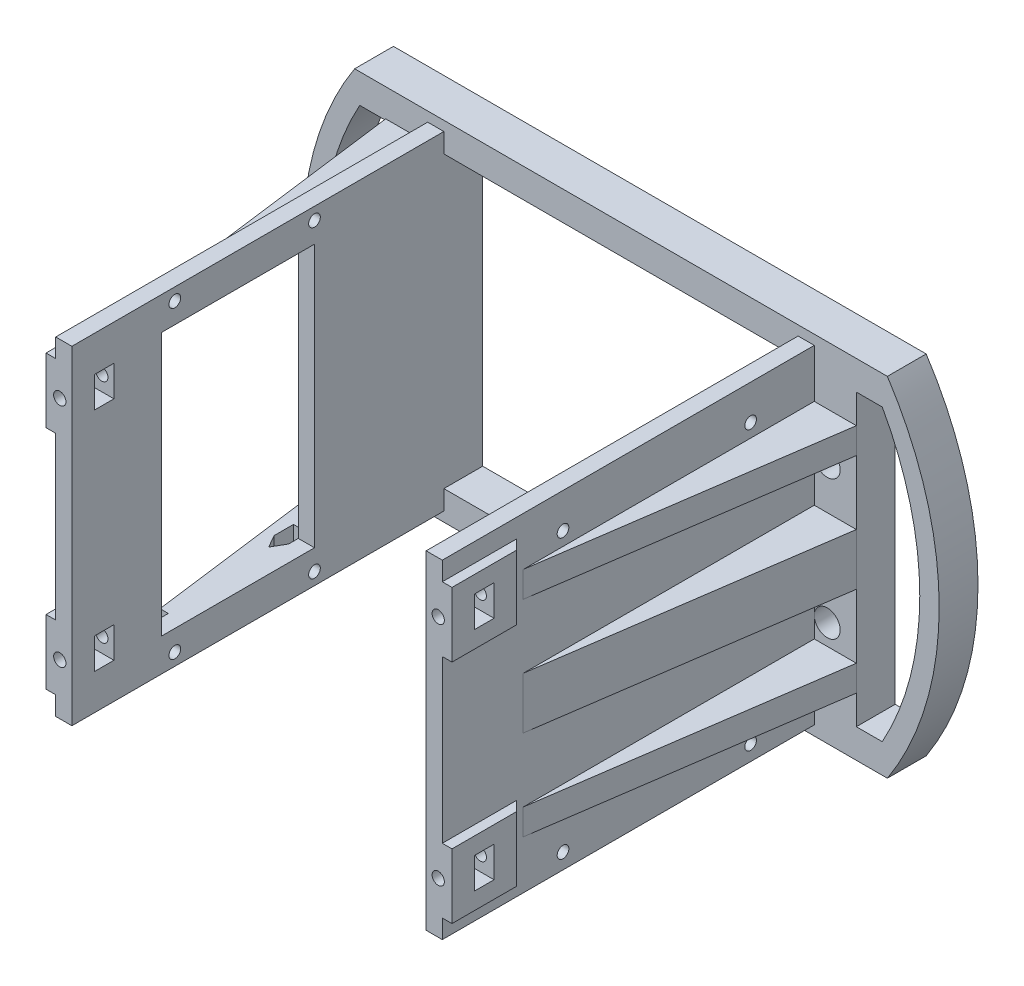
from build123d import *

# Parameters (mm, degrees)
SKETCH1_W                 = 152.4
SKETCH1_H                 = 101.6
BOSS_EXTRUDE1_DEPTH       = 12
F_6_CLEARANCE_HOLE1_D     = 3.7973
BOSS_EXTRUDE2_DEPTH       = 12
SKETCH6_R                 = 4
CUT_EXTRUDE2_DEPTH        = 9.525
SKETCH5_W                 = 109.508
SKETCH5_H                 = 89.6
CUT_EXTRUDE1_DEPTH        = 112.353602017
SKETCH7_W                 = 5
SKETCH7_H                 = 101.6
BOSS_EXTRUDE3_DEPTH       = 100
M3_CLEARANCE_HOLE1_D      = 3.6
SKETCH9_W                 = 47.3
SKETCH9_H                 = 81.28
CUT_EXTRUDE3_DEPTH        = 197.389908957
BOSS_EXTRUDE4_START       = -45.19
BOSS_EXTRUDE4_DEPTH       = 4.55
BOSS_EXTRUDE4_START_2     = 40.64
BOSS_EXTRUDE4_2_DEPTH     = 4.55
CUT_EXTRUDE7_DEPTH        = 178.293724599
CUT_EXTRUDE7_DEPTH_BACK   = 178.293724599
SKETCH12_W                = 5
SKETCH12_H                = 101.6
BOSS_EXTRUDE5_DEPTH       = 90
M3_CLEARANCE_HOLE2_D      = 3.6
M3_CLEARANCE_HOLE2_DEPTH  = 43.6075
BOSS_EXTRUDE6_REACH       = 207.494
SKETCH14_W                = 90.93404203
SKETCH14_H                = 16
SKETCH14_H_2              = 8
BOSS_EXTRUDE7_DEPTH       = 25
BOSS_EXTRUDE8_REACH       = 170.477
SKETCH16_W                = 5
SKETCH16_H                = 101.6
SKETCH27_W                = 25
SKETCH27_H                = 20
BOSS_EXTRUDE10_DEPTH      = 3
CHAMFER1_SIZE             = 5
CHAMFER1_OF_MIRROR1_SIZE  = 5
CUT_EXTRUDE6_DEPTH        = 210.069728417
CUT_EXTRUDE6_DEPTH_BACK   = 210.069728417
SKETCH19_W                = 6
SKETCH19_H                = 9.525
BOSS_EXTRUDE9_START       = -12
BOSS_EXTRUDE9_DEPTH       = 12
F_6_CLEARANCE_HOLE2_D     = 3.7973
F_6_CLEARANCE_HOLE2_DEPTH = 18.859175986
F_6_CLEARANCE_HOLE2_TIP   = 1.140824014


# Read off the part's stored shape, not the designer's step: Boss-Extrude4
with BuildPart() as part:
    # Sketch1 → Boss-Extrude1 (new body)
    with BuildSketch(Plane.XY):
        Rectangle(SKETCH1_W, SKETCH1_H)
    extrude(amount=BOSS_EXTRUDE1_DEPTH)

    # #6 Clearance Hole1 (through all)
    with Locations(Plane(origin=(-63.754, 21.46427, 12), x_dir=(1, 0, 0), z_dir=(0, 0, 1))):
        with Locations((0, 0), (127.508, 0), (127.508, -43.18), (0, -43.18), (63.754, 0), (63.754, -43.18)):
            Hole(F_6_CLEARANCE_HOLE1_D / 2)

    # Sketch4 → Boss-Extrude2 (add)
    with BuildSketch(Plane.XY.offset(12)):
        with BuildLine():
            Line((-76.2, 50.8), (-84.22793291, 50.8))
            ThreePointArc((-84.22793291, 50.8), (-98.3615, 0), (-84.22793291, -50.8))
            Line((-84.22793291, -50.8), (-76.2, -50.8))
            Line((-76.2, -50.8), (-76.2, 50.8))
        make_face()
        with BuildLine():
            Line((76.2, -50.8), (84.22793291, -50.8))
            ThreePointArc((84.22793291, -50.8), (98.3615, 0), (84.22793291, 50.8))
            Line((84.22793291, 50.8), (76.2, 50.8))
            Line((76.2, 50.8), (76.2, -50.8))
        make_face()
    extrude(amount=-BOSS_EXTRUDE2_DEPTH)

    # Sketch6 → Cut-Extrude2 (cut)
    with BuildSketch(Plane.XY.offset(12)):
        with Locations((-63.754, 21.46427)):
            Circle(SKETCH6_R)
        with Locations((63.754, 21.46427)):
            Circle(SKETCH6_R)
        with Locations((63.754, -21.46427)):
            Circle(SKETCH6_R)
        with Locations((-63.754, -21.46427)):
            Circle(SKETCH6_R)
    extrude(amount=-CUT_EXTRUDE2_DEPTH, mode=Mode.SUBTRACT)

    # Sketch5 → Cut-Extrude1 (cut, through all)
    with BuildSketch(Plane.XY.offset(12)):
        with BuildLine():
            Line((-72.754, 44.8), (-72.754, -44.8))
            Line((-72.754, -44.8), (-80.768847226, -44.8))
            ThreePointArc((-80.768847226, -44.8), (-92.3615, 0), (-80.768847226, 44.8))
            Line((-80.768847226, 44.8), (-72.754, 44.8))
        make_face()
        with BuildLine():
            Line((72.754, 44.8), (72.754, -44.8))
            Line((72.754, -44.8), (80.768847226, -44.8))
            ThreePointArc((80.768847226, -44.8), (92.3615, 0), (80.768847226, 44.8))
            Line((80.768847226, 44.8), (72.754, 44.8))
        make_face()
        Rectangle(SKETCH5_W, SKETCH5_H)
    extrude(amount=-CUT_EXTRUDE1_DEPTH, mode=Mode.SUBTRACT)

    # Sketch7 → Boss-Extrude3 (add)
    with BuildSketch(Plane.XY.offset(12)):
        with Locations((-57.254, 0)):
            Rectangle(SKETCH7_W, SKETCH7_H)
    extrude(amount=BOSS_EXTRUDE3_DEPTH)

    # M3 Clearance Hole1 (through all)
    with Locations(Plane(origin=(-54.754, 46.99, 95.18), x_dir=(0, 1, 0), z_dir=(1, 0, 0))):
        with Locations((0, 0), (0, -43.18), (-93.98, -43.18), (-93.98, 0)):
            Hole(M3_CLEARANCE_HOLE1_D / 2)

    # Sketch9 → Cut-Extrude3 (cut, through all)
    with BuildSketch(Plane(origin=(-54.754, 0, 0), x_dir=(0, 0, -1), z_dir=(1, 0, 0))):
        with Locations((-75.65, 0)):
            Rectangle(SKETCH9_W, SKETCH9_H)
    extrude(amount=-CUT_EXTRUDE3_DEPTH, mode=Mode.SUBTRACT)

    # Boss-Extrude4 outline → Boss-Extrude4 (add)
    with BuildSketch(Plane(origin=(0, 0, 0), x_dir=(1, 0, 0), z_dir=(0, 1, 0)).offset(BOSS_EXTRUDE4_START)):
        Polygon((-59.754, -12), (-72.754, -12), (-59.754, -112), align=None)
    extrude(amount=BOSS_EXTRUDE4_DEPTH)

    # Boss-Extrude4 2 outline → Boss-Extrude4 2 (add)
    with BuildSketch(Plane(origin=(0, 0, 0), x_dir=(1, 0, 0), z_dir=(0, 1, 0)).offset(BOSS_EXTRUDE4_START_2)):
        Polygon((-59.754, -12), (-72.754, -12), (-59.754, -112), align=None)
    extrude(amount=BOSS_EXTRUDE4_2_DEPTH)

    # Sketch25 → Cut-Extrude7 (cut, two sides: drawn at the far end of the back side and taken through both)
    with BuildSketch(Plane.XZ.offset(45.19).offset(-CUT_EXTRUDE7_DEPTH_BACK)):
        Polygon((-59.754, 112), (-62.3306, 92.18), (-59.754, 92.18), align=None)
        Polygon((-59.754, 49), (-59.754, 55), (-62.004, 58.897114317), (-64.254, 55), (-64.254, 49), align=None)
    extrude(amount=CUT_EXTRUDE7_DEPTH + CUT_EXTRUDE7_DEPTH_BACK, mode=Mode.SUBTRACT)

    # Sketch12 → Boss-Extrude5 (add)
    with BuildSketch(Plane.XY.offset(12)):
        with Locations((57.254, 0)):
            Rectangle(SKETCH12_W, SKETCH12_H)
    extrude(amount=BOSS_EXTRUDE5_DEPTH)

    # M3 Clearance Hole2
    with Locations(Plane(origin=(54.754, -46, 89.68), x_dir=(0, 0, -1), z_dir=(-1, 0, 0))):
        with Locations((0, 0), (58, 0), (58, -86), (0, -86)):
            Hole(M3_CLEARANCE_HOLE2_D / 2, depth=M3_CLEARANCE_HOLE2_DEPTH)

    # Boss-Extrude6: up to this face of the body (flat: up to its plane)
    boss_extrude6_end = Plane(part.part.faces().sort_by_distance((59.754, 0.013417697, 56.983540958))[0])
    # Sketch14 → Boss-Extrude6 (add, up to the picked face)
    with BuildSketch(Plane(origin=(72.964977627, 0, 10.539385657), x_dir=(-0.14296076265523758, 0, 0.9897283568439539), z_dir=(-0.9897283568439539, 0, -0.14296076265523758)), mode=Mode.PRIVATE) as boss_extrude6_sk1:
        with Locations((46.942793971, 0)):
            Rectangle(SKETCH14_W, SKETCH14_H)
    boss_extrude6_tool1 = split(extrude(boss_extrude6_sk1.sketch, amount=BOSS_EXTRUDE6_REACH, mode=Mode.PRIVATE), bisect_by=boss_extrude6_end, keep=Keep.BOTH, mode=Mode.PRIVATE)
    # Sketch14 → Boss-Extrude6 (add, up to the picked face)
    with BuildSketch(Plane(origin=(72.964977627, 0, 10.539385657), x_dir=(-0.14296076265523758, 0, 0.9897283568439539), z_dir=(-0.9897283568439539, 0, -0.14296076265523758)), mode=Mode.PRIVATE) as boss_extrude6_sk2:
        with Locations((46.942793971, -31.8)):
            Rectangle(SKETCH14_W, SKETCH14_H_2)
    boss_extrude6_tool2 = split(extrude(boss_extrude6_sk2.sketch, amount=BOSS_EXTRUDE6_REACH, mode=Mode.PRIVATE), bisect_by=boss_extrude6_end, keep=Keep.BOTH, mode=Mode.PRIVATE)
    # Sketch14 → Boss-Extrude6 (add, up to the picked face)
    with BuildSketch(Plane(origin=(72.964977627, 0, 10.539385657), x_dir=(-0.14296076265523758, 0, 0.9897283568439539), z_dir=(-0.9897283568439539, 0, -0.14296076265523758)), mode=Mode.PRIVATE) as boss_extrude6_sk3:
        with Locations((46.942793971, 31.8)):
            Rectangle(SKETCH14_W, SKETCH14_H_2)
    boss_extrude6_tool3 = split(extrude(boss_extrude6_sk3.sketch, amount=BOSS_EXTRUDE6_REACH, mode=Mode.PRIVATE), bisect_by=boss_extrude6_end, keep=Keep.BOTH, mode=Mode.PRIVATE)
    add(boss_extrude6_tool1.solids().sort_by(Axis((66.254, 0, 57), (-0.9897283568439539, 0, -0.14296076265523758)))[0])
    add(boss_extrude6_tool2.solids().sort_by(Axis((66.254, -31.8, 57), (-0.9897283568439539, 0, -0.14296076265523758)))[0])
    add(boss_extrude6_tool3.solids().sort_by(Axis((66.254, 31.8, 57), (-0.9897283568439539, 0, -0.14296076265523758)))[0])

    # Sketch15 → Boss-Extrude7 (add)
    with BuildSketch(Plane.XY.offset(102)):
        Polygon((59.754, -8), (59.754, 8), (59.754, 27.8), (59.754, 35.8), (59.754, 50.8), (54.754, 50.8), (54.754, -50.8), (59.754, -50.8), (59.754, -35.8), (59.754, -27.8), align=None)
    extrude(amount=BOSS_EXTRUDE7_DEPTH)

    # Sketch16 → Boss-Extrude8 (add, up to next)
    with BuildSketch(Plane.XY.offset(127), mode=Mode.PRIVATE) as boss_extrude8_sk1:
        with Locations((-57.254, 0)):
            Rectangle(SKETCH16_W, SKETCH16_H)
    boss_extrude8_tool1 = extrude(boss_extrude8_sk1.sketch, amount=-BOSS_EXTRUDE8_REACH, mode=Mode.PRIVATE) - part.part
    add(boss_extrude8_tool1.solids().sort_by_distance((-57.254, 0, 127))[0])

    # Sketch27 → Boss-Extrude10 (add)
    with BuildSketch(Plane.ZY.offset(59.754)):
        with Locations((114.5, 35)):
            Rectangle(SKETCH27_W, SKETCH27_H)
        with Locations((114.5, -35)):
            Rectangle(SKETCH27_W, SKETCH27_H)
    boss_extrude10 = extrude(amount=BOSS_EXTRUDE10_DEPTH)

    # Chamfer1
    # the kernel refuses this chamfer: 5 mm, written as the material it takes off along each edge
    with BuildSketch(Plane(origin=(-62.754, -57.85841494, 102), x_dir=(0.9996219169112968, 0, -0.0274958766105877), z_dir=(0, 1, 0))) as chamfer1_piece_1_section:
        Polygon((CHAMFER1_SIZE * 0.999621916911, -CHAMFER1_SIZE * 0.0274958766106), (-CHAMFER1_SIZE * 0.0274958766106, -CHAMFER1_SIZE * 0.999621916911), (0, 0), align=None)
    chamfer1_piece_1 = extrude(amount=45.71682988, mode=Mode.PRIVATE)
    chamfer1_piece_1 = split(chamfer1_piece_1, bisect_by=Plane(origin=(-59.754, -35, 103.875047298), z_dir=(-1, 0, 0)), keep=Keep.TOP, mode=Mode.PRIVATE)
    add(chamfer1_piece_1, mode=Mode.SUBTRACT)
    with BuildSketch(Plane(origin=(-62.754, 12.14158506, 102), x_dir=(0.9996219169112968, 0, -0.0274958766105877), z_dir=(0, 1, 0))) as chamfer1_piece_2_section:
        Polygon((CHAMFER1_SIZE * 0.999621916911, -CHAMFER1_SIZE * 0.0274958766106), (-CHAMFER1_SIZE * 0.0274958766106, -CHAMFER1_SIZE * 0.999621916911), (0, 0), align=None)
    chamfer1_piece_2 = extrude(amount=45.71682988, mode=Mode.PRIVATE)
    chamfer1_piece_2 = split(chamfer1_piece_2, bisect_by=Plane(origin=(-59.754, 35, 103.875047298), z_dir=(-1, 0, 0)), keep=Keep.TOP, mode=Mode.PRIVATE)
    add(chamfer1_piece_2, mode=Mode.SUBTRACT)

    # Mirror1: Boss-Extrude10 across plane
    add(boss_extrude10.mirror(Plane(origin=(0, 0, 0), x_dir=(0, 0, 1), z_dir=(1, 0, 0))))

    # Chamfer1 of Mirror1
    # the kernel refuses this chamfer: 5 mm, written as the material it takes off along each edge
    with BuildSketch(Plane(origin=(62.754, -57.85841494, 102), x_dir=(-0.9996219169112968, 0, -0.0274958766105877), z_dir=(0, 1, 0))) as chamfer1_of_mirror1_piece_1_section:
        Polygon((CHAMFER1_OF_MIRROR1_SIZE * 0.999621916911, CHAMFER1_OF_MIRROR1_SIZE * 0.0274958766106), (-CHAMFER1_OF_MIRROR1_SIZE * 0.0274958766106, CHAMFER1_OF_MIRROR1_SIZE * 0.999621916911), (0, 0), align=None)
    chamfer1_of_mirror1_piece_1 = extrude(amount=45.71682988, mode=Mode.PRIVATE)
    chamfer1_of_mirror1_piece_1 = split(chamfer1_of_mirror1_piece_1, bisect_by=Plane(origin=(59.754, -35, 103.875206366), z_dir=(1, 0, 0)), keep=Keep.TOP, mode=Mode.PRIVATE)
    chamfer1_of_mirror1_piece_1 = split(chamfer1_of_mirror1_piece_1, bisect_by=Plane(origin=(59.525120657, -35, 103.584549298), z_dir=(0.9897283568439539, 0, 0.14296076265523758)), keep=Keep.TOP, mode=Mode.PRIVATE)
    add(chamfer1_of_mirror1_piece_1, mode=Mode.SUBTRACT)
    with BuildSketch(Plane(origin=(62.754, 12.14158506, 102), x_dir=(-0.9996219169112968, 0, -0.0274958766105877), z_dir=(0, 1, 0))) as chamfer1_of_mirror1_piece_2_section:
        Polygon((CHAMFER1_OF_MIRROR1_SIZE * 0.999621916911, CHAMFER1_OF_MIRROR1_SIZE * 0.0274958766106), (-CHAMFER1_OF_MIRROR1_SIZE * 0.0274958766106, CHAMFER1_OF_MIRROR1_SIZE * 0.999621916911), (0, 0), align=None)
    chamfer1_of_mirror1_piece_2 = extrude(amount=45.71682988, mode=Mode.PRIVATE)
    chamfer1_of_mirror1_piece_2 = split(chamfer1_of_mirror1_piece_2, bisect_by=Plane(origin=(59.754, 35, 103.875206366), z_dir=(1, 0, 0)), keep=Keep.TOP, mode=Mode.PRIVATE)
    chamfer1_of_mirror1_piece_2 = split(chamfer1_of_mirror1_piece_2, bisect_by=Plane(origin=(59.525120657, 35, 103.584549298), z_dir=(0.9897283568439539, 0, 0.14296076265523758)), keep=Keep.TOP, mode=Mode.PRIVATE)
    add(chamfer1_of_mirror1_piece_2, mode=Mode.SUBTRACT)

    # Sketch19 → Cut-Extrude6 (cut, two sides: drawn at the far end of the back side and taken through both)
    with BuildSketch(Plane.ZY.offset(59.754).offset(-CUT_EXTRUDE6_DEPTH_BACK)):
        with Locations((117, 35)):
            Rectangle(SKETCH19_W, SKETCH19_H)
        with Locations((117, -35)):
            Rectangle(SKETCH19_W, SKETCH19_H)
    extrude(amount=CUT_EXTRUDE6_DEPTH + CUT_EXTRUDE6_DEPTH_BACK, mode=Mode.SUBTRACT)

    # Sketch20 → Boss-Extrude9 (add)
    with BuildSketch(Plane(origin=(0, 0, 0), x_dir=(-1, 0, 0), z_dir=(0, 0, -1)).offset(BOSS_EXTRUDE9_START)):
        with BuildLine():
            Line((-82.344062823, 53.8), (82.344062823, 53.8))
            ThreePointArc((82.344062823, 53.8), (83.299504444, 52.308481546), (84.22793291, 50.8))
            Line((84.22793291, 50.8), (-84.22793291, 50.8))
            ThreePointArc((-84.22793291, 50.8), (-83.299504444, 52.308481546), (-82.344062823, 53.8))
        make_face()
        with BuildLine():
            Line((-84.22793291, -50.8), (84.22793291, -50.8))
            ThreePointArc((84.22793291, -50.8), (83.299504444, -52.308481546), (82.344062823, -53.8))
            Line((82.344062823, -53.8), (-82.344062823, -53.8))
            ThreePointArc((-82.344062823, -53.8), (-83.299504444, -52.308481546), (-84.22793291, -50.8))
        make_face()
    extrude(amount=BOSS_EXTRUDE9_DEPTH)

    # #6 Clearance Hole2
    with Locations(Plane(origin=(-58.5, 35, 127), x_dir=(1, 0, 0), z_dir=(0, 0, 1))):
        with Locations((0, 0), (117, 0), (117, -70), (0, -70)):
            Hole(F_6_CLEARANCE_HOLE2_D / 2, depth=F_6_CLEARANCE_HOLE2_DEPTH)
            with Locations((0, 0, -(F_6_CLEARANCE_HOLE2_DEPTH + F_6_CLEARANCE_HOLE2_TIP / 2))):  # 118° drill point
                Cone(0, F_6_CLEARANCE_HOLE2_D / 2, F_6_CLEARANCE_HOLE2_TIP, mode=Mode.SUBTRACT)


solid = part.part
